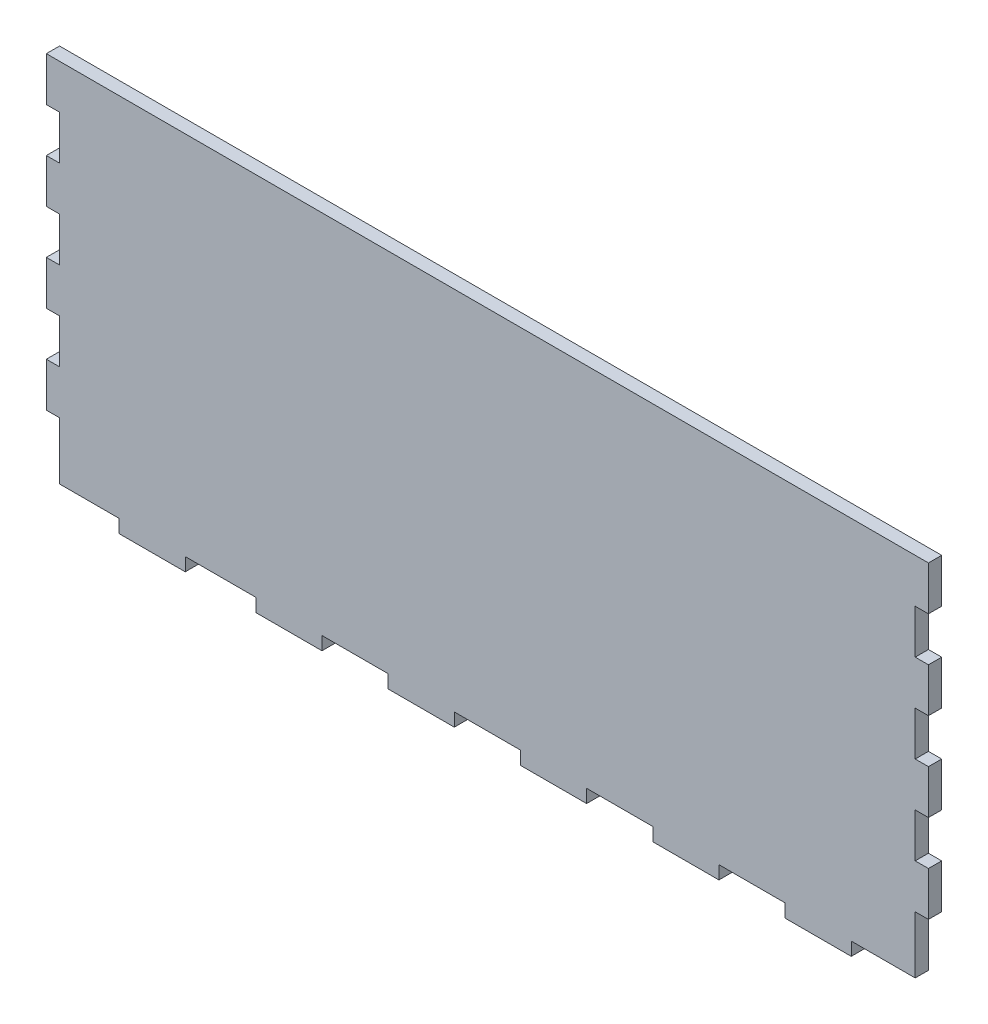
from build123d import *

# Parameters (mm, degrees)
BOSS_EXTRUDE1_DEPTH = 3


with BuildPart() as part:
    # Sketch1 → Boss-Extrude1 (new body)
    with BuildSketch(Plane.XY):
        Polygon((-97, -12.5), (-97, -25.5), (-83.5, -25.5), (-83.5, -28.5), (-68.5, -28.5), (-68.5, -25.5), (-52.5, -25.5), (-52.5, -28.5), (-37.5, -28.5), (-37.5, -25.5), (-22.5, -25.5), (-22.5, -28.5), (-7.5, -28.5), (-7.5, -25.5), (0, -25.5), (7.5, -25.5), (7.5, -28.5), (22.5, -28.5), (22.5, -25.5), (30, -25.5), (37.5, -25.5), (37.5, -28.5), (52.5, -28.5), (52.5, -25.5), (60, -25.5), (67.5, -25.5), (67.5, -28.5), (82.5, -28.5), (82.5, -25.5), (97, -25.5), (97, -12.5), (100, -12.5), (100, -2.5), (97, -2.5), (97, 7.5), (100, 7.5), (100, 17.5), (97, 17.5), (97, 27.5), (100, 27.5), (100, 37.5), (97, 37.5), (97, 47.5), (100, 47.5), (100, 57.5), (97, 57.5), (-97, 57.5), (-100, 57.5), (-100, 47.5), (-97, 47.5), (-97, 37.5), (-100, 37.5), (-100, 27.5), (-97, 27.5), (-97, 17.5), (-100, 17.5), (-100, 7.5), (-97, 7.5), (-97, -2.5), (-100, -2.5), (-100, -12.5), align=None)
    extrude(amount=BOSS_EXTRUDE1_DEPTH)


solid = part.part
